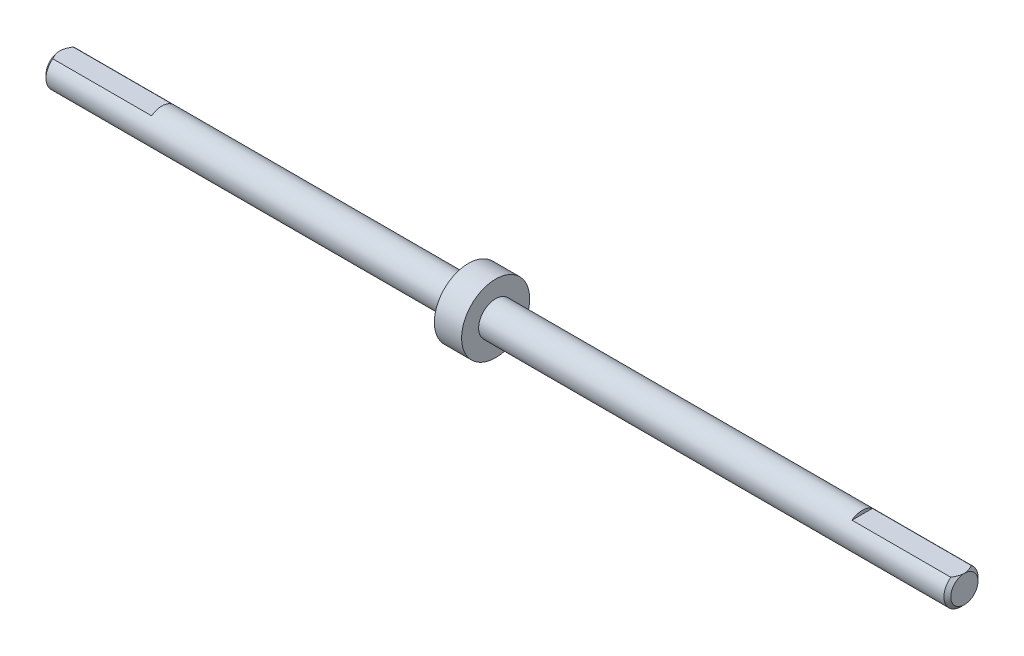
from build123d import *

# Parameters (mm, degrees)
SKETCH1_W           = 4
SKETCH1_H           = 5
SKETCH2_R           = 2.5
BOSS_EXTRUDE1_DEPTH = 68.8
CUT_EXTRUDE1_START  = -15
CUT_EXTRUDE1_DEPTH  = 15
BOSS_EXTRUDE2_START = 60
SKETCH4_R           = 2.5
BOSS_EXTRUDE2_DEPTH = 60
CUT_EXTRUDE2_DEPTH  = 15
CHAMFER1_SIZE       = 0.5


with BuildPart() as part:
    # Sketch1 → Revolve1 (revolve)
    with BuildSketch(Plane(origin=(0, 0, 0), x_dir=(-1, 0, 0), z_dir=(0, 0, -1)), mode=Mode.PRIVATE) as revolve1_sk:
        with Locations((-7, 2.5)):
            Rectangle(SKETCH1_W, SKETCH1_H)
    revolve(revolve1_sk.sketch.rotate(Axis((9, 0, 0), (-1, 0, 0)), 270), axis=Axis((9, 0, 0), (-1, 0, 0)))

    # Sketch2 → Boss-Extrude1 (add)
    with BuildSketch(Plane(origin=(9, 0, 0), x_dir=(0, 0, -1), z_dir=(1, 0, 0))):
        with Locations(Location((0, 0, 0), (0, 0, 180))):
            Circle(SKETCH2_R)
    extrude(amount=BOSS_EXTRUDE1_DEPTH)

    # Sketch3 → Cut-Extrude1 (cut)
    with BuildSketch(Plane(origin=(77.8, 0, 0), x_dir=(0, 0, -1), z_dir=(1, 0, 0)).offset(CUT_EXTRUDE1_START)):
        with BuildLine():
            Line((-1.5, 2), (1.5, 2))
            ThreePointArc((1.5, 2), (0, 2.5), (-1.5, 2))
        make_face()
    extrude(amount=CUT_EXTRUDE1_DEPTH, mode=Mode.SUBTRACT)

    # Sketch4 → Boss-Extrude2 (add)
    with BuildSketch(Plane.ZY.offset(-5).offset(BOSS_EXTRUDE2_START)):
        with Locations(Location((0, 0, 0), (0, 0, 53.130102354))):
            Circle(SKETCH4_R)
    extrude(amount=-BOSS_EXTRUDE2_DEPTH)

    # Sketch5 → Cut-Extrude2 (cut)
    with BuildSketch(Plane.ZY.offset(55)):
        with BuildLine():
            Line((-1.5, 2), (1.5, 2))
            ThreePointArc((1.5, 2), (0, 2.5), (-1.5, 2))
        make_face()
    extrude(amount=-CUT_EXTRUDE2_DEPTH, mode=Mode.SUBTRACT)

    # Chamfer1
    chamfer1_edges = [part.edges().sort_by_distance(p)[0] for p in [
        (-55, -2.5, 0),
        (77.8, -2.236067977, -1.118033989),
    ]]
    chamfer(chamfer1_edges, length=CHAMFER1_SIZE - 0.0001)  # a hair under: the kernel refuses the full size


solid = part.part
